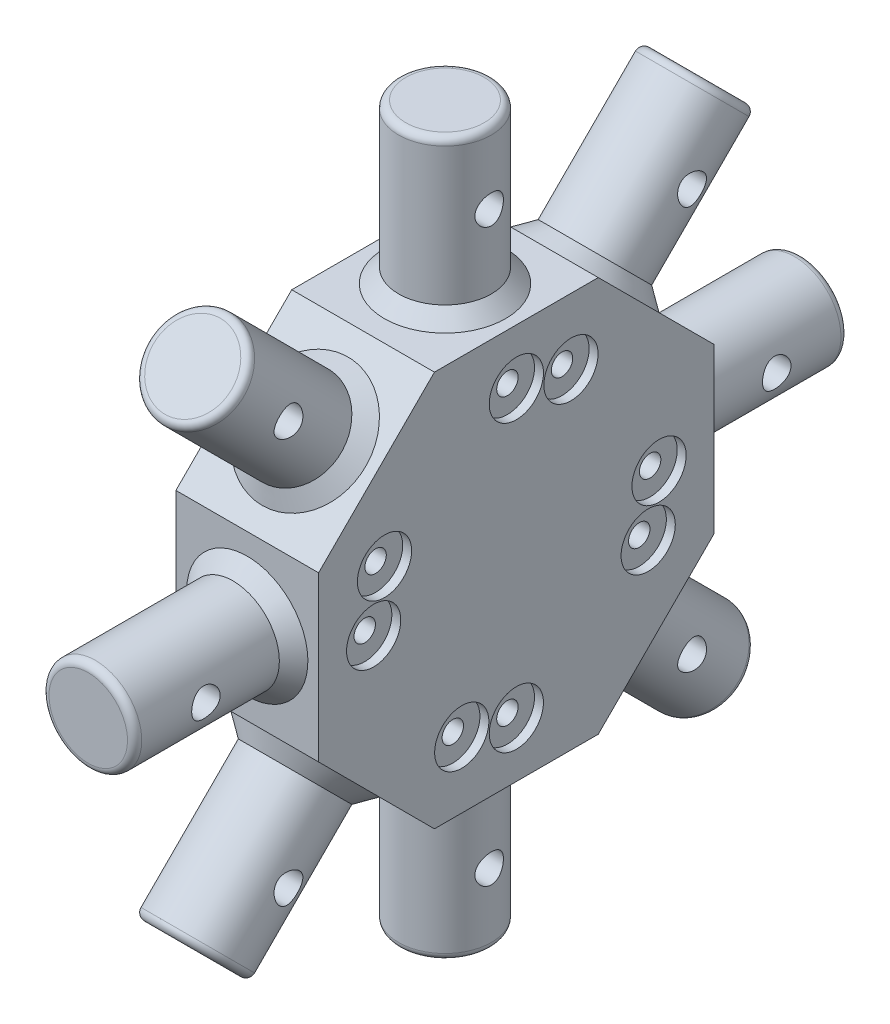
from build123d import *

# Parameters (mm, degrees)
SKETCH1_R               = 38.1
BOSS_EXTRUDE1_DEPTH     = 12.7
SKETCH11_OUTSIDE_W      = 100.344
SKETCH11_OUTSIDE_H      = 100.344
CUT_EXTRUDE6_DEPTH      = 60.56828015
BOSS_EXTRUDE2_START     = 35.199810189
BOSS_EXTRUDE2_OUTLINE_R = 8.255
BOSS_EXTRUDE2_DEPTH     = 28.300189811
CIRPATTERN1_COUNT       = 8
SKETCH3_R               = 2.54
CUT_EXTRUDE1_DEPTH      = 91.696141042
CIRPATTERN2_COUNT       = 8
SKETCH4_R               = 1.905
CUT_EXTRUDE2_DEPTH      = 91.696141183
SKETCH8_R               = 4.826
CUT_EXTRUDE3_DEPTH      = 1.5875
CIRPATTERN3_COUNT       = 16
FILLET2_R               = 1.27
CHAMFER1_SIZE           = 2.54


# Read off the part's stored shape, not the designer's step: Boss-Extrude2
with BuildPart() as part:
    # Sketch1 → Boss-Extrude1 (new, symmetric)
    with BuildSketch(Plane(origin=(0, 0, 0), x_dir=(0, 0, -1), z_dir=(1, 0, 0))):
        Circle(SKETCH1_R)
    extrude(amount=BOSS_EXTRUDE1_DEPTH, both=True)

    # Sketch11 outside → Cut-Extrude6 (cut, through all)
    with BuildSketch(Plane(origin=(12.7, 0, 0), x_dir=(0, 0, -1), z_dir=(1, 0, 0))):
        Rectangle(SKETCH11_OUTSIDE_W, SKETCH11_OUTSIDE_H)
        Polygon((35.199810189, 14.580238773), (14.580238773, 35.199810189), (-14.580238773, 35.199810189), (-35.199810189, 14.580238773), (-35.199810189, -14.580238773), (-14.580238773, -35.199810189), (14.580238773, -35.199810189), (35.199810189, -14.580238773), align=None, mode=Mode.SUBTRACT)
    extrude(amount=-CUT_EXTRUDE6_DEPTH, mode=Mode.SUBTRACT)

    # Boss-Extrude2 outline → Boss-Extrude2 (add)
    with BuildSketch(Plane(origin=(0, 0, 0), x_dir=(1, 0, 0), z_dir=(0, 1, 0)).offset(BOSS_EXTRUDE2_START)):
        Circle(BOSS_EXTRUDE2_OUTLINE_R)
    boss_extrude2 = extrude(amount=BOSS_EXTRUDE2_DEPTH)

    # CirPattern1: Boss-Extrude2 ×8 about axis
    cirpattern1_axis = Axis((0, 0, 0), (1, 0, 0))
    for i in range(1, CIRPATTERN1_COUNT):
        add(boss_extrude2.rotate(cirpattern1_axis, i * 360 / CIRPATTERN1_COUNT))

    # Sketch3 → Cut-Extrude1 (cut, symmetric)
    with BuildSketch(Plane(origin=(0, 0, 0), x_dir=(0, 0, -1), z_dir=(1, 0, 0))):
        with Locations((0, 50.8)):
            Circle(SKETCH3_R)
    cut_extrude1 = extrude(amount=CUT_EXTRUDE1_DEPTH, both=True, mode=Mode.SUBTRACT)

    # CirPattern2: Cut-Extrude1 ×8 about axis
    cirpattern2_axis = Axis((0, 0, 0), (1, 0, 0))
    for i in range(1, CIRPATTERN2_COUNT):
        add(cut_extrude1.rotate(cirpattern2_axis, i * 360 / CIRPATTERN2_COUNT), mode=Mode.SUBTRACT)

    # Sketch4 → Cut-Extrude2 (cut, symmetric)
    with BuildSketch(Plane(origin=(0, 0, 0), x_dir=(0, 0, -1), z_dir=(1, 0, 0))):
        with Locations((0, 25.4)):
            Circle(SKETCH4_R)
    cut_extrude2 = extrude(amount=CUT_EXTRUDE2_DEPTH, both=True, mode=Mode.SUBTRACT)

    # Sketch8 → Cut-Extrude3 (cut)
    with BuildSketch(Plane(origin=(12.7, 0, 0), x_dir=(0, 0, -1), z_dir=(1, 0, 0))):
        with Locations((0, 25.4)):
            Circle(SKETCH8_R)
    cut_extrude3 = extrude(amount=-CUT_EXTRUDE3_DEPTH, mode=Mode.SUBTRACT)

    # CirPattern3: Cut-Extrude2, Cut-Extrude3 ×16 about axis, 8 skipped
    cirpattern3_axis = Axis((0, 0, 0), (-1, 0, 0))
    add([cut_extrude2.rotate(cirpattern3_axis, i * 360 / CIRPATTERN3_COUNT) for i in range(1, CIRPATTERN3_COUNT) if i not in (2, 3, 6, 7, 10, 11, 14, 15)], mode=Mode.SUBTRACT)
    add([cut_extrude3.rotate(cirpattern3_axis, i * 360 / CIRPATTERN3_COUNT) for i in range(1, CIRPATTERN3_COUNT) if i not in (2, 3, 6, 7, 10, 11, 14, 15)], mode=Mode.SUBTRACT)

    # Fillet2
    fillet2_edges = [part.edges().sort_by_distance(p)[0] for p in [
        (-8.255, 63.5, 0),
        (-8.255, 44.901280605, -44.901280605),
        (-8.255, 0, -63.5),
        (-8.255, -44.901280605, -44.901280605),
        (-8.255, -63.5, 0),
        (-8.255, -44.901280605, 44.901280605),
        (-8.255, 0, 63.5),
        (-8.255, 44.901280605, 44.901280605),
    ]]
    fillet(fillet2_edges, radius=FILLET2_R)

    # Chamfer1
    chamfer1_edges = [part.edges().sort_by_distance(p)[0] for p in [
        (-8.255, 35.199810189, 0),
        (-8.255, 24.890024481, -24.890024481),
        (-8.255, 0, -35.199810189),
        (-8.255, -24.890024481, -24.890024481),
        (-8.255, -35.199810189, 0),
        (-8.255, -24.890024481, 24.890024481),
        (-8.255, 0, 35.199810189),
        (-8.255, 24.890024481, 24.890024481),
    ]]
    chamfer(chamfer1_edges, length=CHAMFER1_SIZE)


solid = part.part
